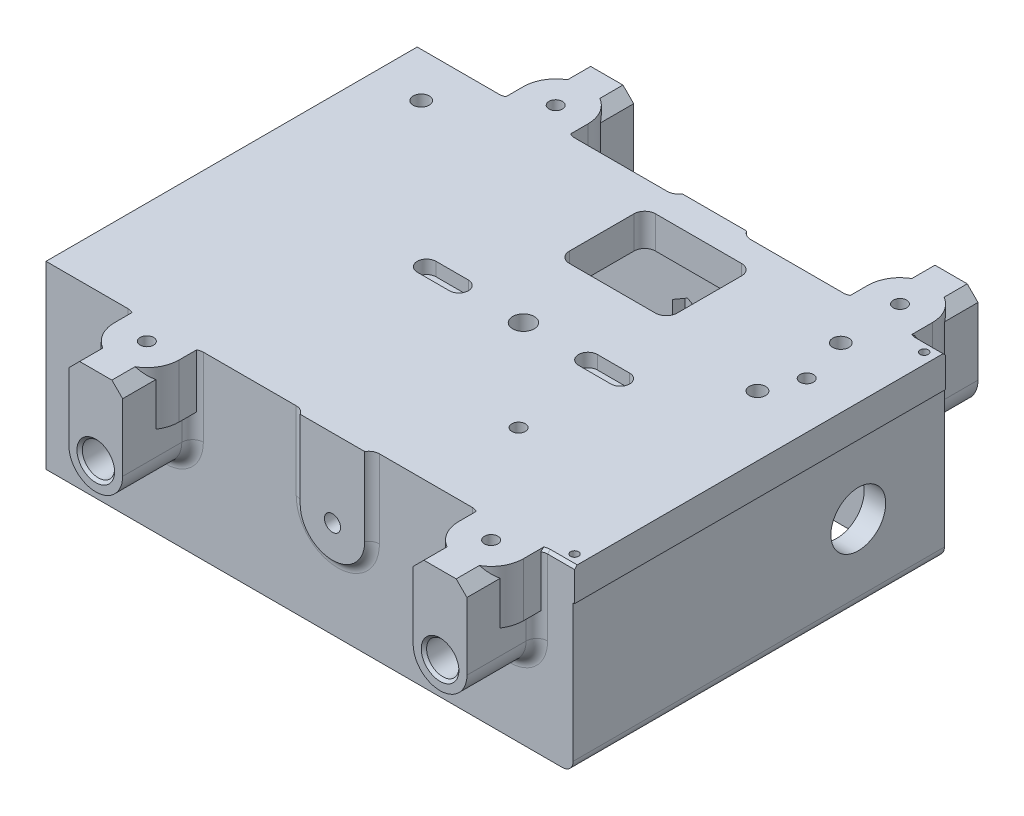
from build123d import *

# Parameters (mm, degrees)
ESQUISSE2_W                   = 98.25
ESQUISSE2_H                   = 69
BOSS_EXTRU_1_DEPTH            = 6
ESQUISSE3_W                   = 98
ESQUISSE3_H                   = 69
ESQUISSE3_W_2                 = 90
ESQUISSE3_H_2                 = 61
BOSS_EXTRU_2_DEPTH            = 27.5
ESQUISSE7_W                   = 75
ESQUISSE7_H                   = 3
BOSS_EXTRU_3_DEPTH            = 22.5
ENL_V_MAT_EXTRU_1_REACH       = 68.029
ESQUISSE4_W                   = 20
ESQUISSE4_H                   = 16
ENL_V_MAT_EXTRU_2_DEPTH       = 5
ENL_V_MAT_EXTRU_3_DEPTH       = 2
CONG_4_R                      = 2
ESQUISSE9_W                   = 1.6
ESQUISSE9_H                   = 2
BOSS_EXTRU_4_DEPTH            = 6.5
CHANFREIN1_SIZE               = 0.5
ENL_V_MAT_EXTRU_4_DEPTH       = 7.5
ENL_V_MAT_EXTRU_5_REACH       = 109.473
ESQUISSE11_R                  = 5.1
CONG_5_R                      = 2
ESQUISSE15_R                  = 1.25
ENL_V_MAT_EXTRU_8_DEPTH       = 3
ENL_V_MAT_EXTRU_9_DEPTH       = 2.5
ESQUISSE18_W                  = 7.5
ESQUISSE18_H                  = 3
ENL_V_MAT_EXTRU_11_DEPTH      = 22.5
ENL_V_MAT_EXTRU_10_DEPTH      = 3
ENL_V_MAT_EXTRU_12_REACH      = 70.744
ESQUISSE19_R                  = 2
ENL_V_MAT_EXTRU_13_DEPTH      = 2.3
BOSS_EXTRU_6_DEPTH            = 1
CONG_6_R                      = 2
ENL_V_MAT_EXTRU_14_DEPTH      = 91.611895604
ENL_V_MAT_EXTRU_14_DEPTH_BACK = 91.611895604
ESQUISSE22_R                  = 1.5
BOSS_EXTRU_8_DEPTH            = 13
BOSS_EXTRU_9_DEPTH            = 13
ESQUISSE26_R                  = 3
ENL_V_MAT_EXTRU_15_DEPTH      = 5
CHANFREIN3_SIZE               = 0.5
BOSS_EXTRU_10_DEPTH           = 10
CHANFREIN4_SIZE               = 2
CONG_7_R                      = 2
ESQUISSE32_R                  = 1.25
ENL_V_MAT_EXTRU_18_DEPTH      = 10
CHANFREIN3_OF_SYM_TRIE4_SIZE  = 0.5
CHANFREIN4_OF_SYM_TRIE4_SIZE  = 2
CONG_12_R                     = 2
BOSS_EXTRU_11_DEPTH           = 3.35
ESQUISSE29_R                  = 0.75
ENL_V_MAT_EXTRU_16_DEPTH      = 5
BOSS_EXTRU_12_DEPTH           = 5.2
ESQUISSE31_R                  = 1.5
ENL_V_MAT_EXTRU_17_DEPTH      = 72.880495442
ESQUISSE33_R                  = 0.75
ENL_V_MAT_EXTRU_19_DEPTH      = 10
CHANFREIN5_SIZE               = 0.5


with BuildPart() as part:
    # Esquisse2 → Boss.-Extru.1 (new body)
    with BuildSketch(Plane(origin=(0, 0, 0), x_dir=(1, 0, 0), z_dir=(0, 1, 0))):
        Rectangle(ESQUISSE2_W, ESQUISSE2_H)
    extrude(amount=BOSS_EXTRU_1_DEPTH)

    # Esquisse3 → Boss.-Extru.2 (add)
    with BuildSketch(Plane.XZ):
        with Locations((-0.125, 0)):
            Rectangle(ESQUISSE3_W, ESQUISSE3_H)
        with Locations((-0.125, 0)):
            Rectangle(ESQUISSE3_W_2, ESQUISSE3_H_2, mode=Mode.SUBTRACT)
    extrude(amount=BOSS_EXTRU_2_DEPTH)

    # Esquisse7 → Boss.-Extru.3 (add)
    with BuildSketch(Plane.XZ):
        with Locations((7.375, -5)):
            Rectangle(ESQUISSE7_W, ESQUISSE7_H)
    extrude(amount=BOSS_EXTRU_3_DEPTH)

    # Esquisse4 → Enlèv. mat.-Extru.1 (cut, up to next)
    with BuildSketch(Plane.XZ, mode=Mode.PRIVATE) as enl_v_mat_extru_1_sk1:
        with Locations((7.875, -21.8)):
            Rectangle(ESQUISSE4_W, ESQUISSE4_H)
    enl_v_mat_extru_1_tool1 = extrude(enl_v_mat_extru_1_sk1.sketch, amount=-ENL_V_MAT_EXTRU_1_REACH, mode=Mode.PRIVATE) & part.part
    add(enl_v_mat_extru_1_tool1.solids().sort_by_distance((7.875, 0, -21.8))[0], mode=Mode.SUBTRACT)

    # Esquisse5 → Enlèv. mat.-Extru.2 (cut, symmetric)
    with BuildSketch(Plane.XY.offset(17.5)):
        with BuildLine():
            Line((44.875, -20.00392669), (44.875, -22.080817294))
            ThreePointArc((44.875, -22.080817294), (46.083005876, -23.318494685), (45.984422146, -25.045169167))
            ThreePointArc((45.984422146, -25.045169167), (46.420169167, -26.390577854), (47.765577854, -25.954830833))
            ThreePointArc((47.765577854, -25.954830833), (47.802551126, -22.259388289), (44.875, -20.00392669))
        make_face()
    enl_v_mat_extru_2 = extrude(amount=ENL_V_MAT_EXTRU_2_DEPTH, both=True, mode=Mode.SUBTRACT)

    # Esquisse6 → Enlèv. mat.-Extru.3 (cut, symmetric)
    with BuildSketch(Plane.XY.offset(17.5)):
        with BuildLine():
            Line((44.875, -22.080817294), (47.710396034, -22.080817294))
            ThreePointArc((47.710396034, -22.080817294), (48.103029418, -25.04361757), (46.400521912, -27.5))
            Line((46.400521912, -27.5), (44.875, -27.5))
            Line((44.875, -27.5), (44.875, -22.080817294))
        make_face()
    enl_v_mat_extru_3 = extrude(amount=ENL_V_MAT_EXTRU_3_DEPTH, both=True, mode=Mode.SUBTRACT)

    # Symétrie1: Enlèv. mat.-Extru.2, Enlèv. mat.-Extru.3 across plane
    add(enl_v_mat_extru_2.mirror(Plane.XY), mode=Mode.SUBTRACT)
    add(enl_v_mat_extru_3.mirror(Plane.XY), mode=Mode.SUBTRACT)

    # Congé4
    # the kernel refuses this fillet: 2 mm, written as the material it takes off along each edge
    with BuildSketch(Plane(origin=(44.875, -27.5, 20.5), x_dir=(1, 0, 0), z_dir=(0, 0, -1))) as cong_4_piece_1:
        with BuildLine():
            CenterArc((CONG_4_R, -CONG_4_R), CONG_4_R, 90, 90)
            Line((0, -CONG_4_R), (0, 0))
            Line((0, 0), (CONG_4_R, 0))
        make_face()
    extrude(amount=41, mode=Mode.SUBTRACT)
    with BuildSketch(Plane(origin=(48.875, -27.5, -39.5), x_dir=(0, 1, 0), z_dir=(0, 0, 1))) as cong_4_piece_2:
        with BuildLine():
            CenterArc((CONG_4_R, CONG_4_R), CONG_4_R, 180, 90)
            Line((0, CONG_4_R), (0, 0))
            Line((0, 0), (CONG_4_R, 0))
        make_face()
    extrude(amount=79, mode=Mode.SUBTRACT)
    with BuildSketch(Plane(origin=(44.875, -27.5, -14.5), x_dir=(1, 0, 0), z_dir=(0, 0, -1)), Plane(origin=(44.875, -27.5, 30.5), x_dir=(1, 0, 0), z_dir=(0, 0, -1))) as cong_4_piece_3:
        with BuildLine():
            CenterArc((CONG_4_R, -CONG_4_R), CONG_4_R, 90, 90)
            Line((0, -CONG_4_R), (0, 0))
            Line((0, 0), (CONG_4_R, 0))
        make_face()
    extrude(amount=16, mode=Mode.SUBTRACT)

    # Esquisse9 → Boss.-Extru.4 (add, symmetric)
    with BuildSketch(Plane.XY.offset(-10)):
        with Locations((-44.325, -24.5)):
            Rectangle(ESQUISSE9_W, ESQUISSE9_H)
    extrude(amount=BOSS_EXTRU_4_DEPTH, both=True)

    # Chanfrein1
    chanfrein1_edges = [part.edges().sort_by_distance(p)[0] for p in [
        (-43.525, -25.5, -10),
        (-43.525, -23.5, -10),
    ]]
    chamfer(chanfrein1_edges, length=CHANFREIN1_SIZE)

    # Esquisse10 → Enlèv. mat.-Extru.4 (cut, symmetric)
    with BuildSketch(Plane.XY.offset(-10)):
        with BuildLine():
            Line((-45.125, -25.5), (-45.125, -27.5))
            Line((-45.125, -27.5), (-48.125, -27.5))
            ThreePointArc((-48.125, -27.5), (-46.811551486, -26.220172772), (-45.125, -25.5))
        make_face()
    extrude(amount=ENL_V_MAT_EXTRU_4_DEPTH, both=True, mode=Mode.SUBTRACT)

    # Esquisse11 → Enlèv. mat.-Extru.5 (cut, up to next)
    with BuildSketch(Plane(origin=(48.875, 0, 0), x_dir=(0, 0, -1), z_dir=(1, 0, 0)), mode=Mode.PRIVATE) as enl_v_mat_extru_5_sk1:
        with Locations((18.5, -13)):
            Circle(ESQUISSE11_R)
    enl_v_mat_extru_5_tool1 = extrude(enl_v_mat_extru_5_sk1.sketch, amount=-ENL_V_MAT_EXTRU_5_REACH, mode=Mode.PRIVATE) & part.part
    add(enl_v_mat_extru_5_tool1.solids().sort_by_distance((48.875, -13, -18.5))[0], mode=Mode.SUBTRACT)

    # Congé5
    cong_5_edges = [part.edges().sort_by_distance(p)[0] for p in [
        (-2.125, 3, -29.8),
        (-2.125, 3, -13.8),
        (17.875, 3, -13.8),
        (17.875, 3, -29.8),
    ]]
    fillet(cong_5_edges, radius=CONG_5_R)

    # Esquisse15 → Enlèv. mat.-Extru.8 (cut)
    with BuildSketch(Plane(origin=(0, 6, 0), x_dir=(1, 0, 0), z_dir=(0, 1, 0))):
        with Locations(Location((40.425, 17.355, 0), (0, 0, 270))):
            Circle(ESQUISSE15_R)
        with Locations(Location((21.575, -17.355, 0), (0, 0, 270))):
            Circle(ESQUISSE15_R)
    extrude(amount=-ENL_V_MAT_EXTRU_8_DEPTH, mode=Mode.SUBTRACT)

    # Esquisse16 → Enlèv. mat.-Extru.9 (cut)
    with BuildSketch(Plane(origin=(0, 6, 0), x_dir=(1, 0, 0), z_dir=(0, 1, 0))):
        with BuildLine():
            Line((-12.875, 1.75), (-6.875, 1.75))
            ThreePointArc((-6.875, 1.75), (-5.125, 0), (-6.875, -1.75))
            Line((-6.875, -1.75), (-12.875, -1.75))
            ThreePointArc((-12.875, -1.75), (-14.625, 0), (-12.875, 1.75))
        make_face()
        with BuildLine():
            Line((23.125, 1.75), (17.125, 1.75))
            ThreePointArc((17.125, 1.75), (15.375, 0), (17.125, -1.75))
            Line((17.125, -1.75), (23.125, -1.75))
            ThreePointArc((23.125, -1.75), (24.875, 0), (23.125, 1.75))
        make_face()
    extrude(amount=-ENL_V_MAT_EXTRU_9_DEPTH, mode=Mode.SUBTRACT)

    # Esquisse18 → Enlèv. mat.-Extru.11 (cut)
    with BuildSketch(Plane.XZ.offset(22.5)):
        with Locations((5.125, -5)):
            Rectangle(ESQUISSE18_W, ESQUISSE18_H)
    extrude(amount=-ENL_V_MAT_EXTRU_11_DEPTH, mode=Mode.SUBTRACT)

    # Esquisse17 → Enlèv. mat.-Extru.10 (cut)
    with BuildSketch(Plane.XZ):
        Polygon((5.125, 4.099186911), (1.575, 2.049593456), (1.575, -2.049593456), (5.125, -4.099186911), (8.675, -2.049593456), (8.675, 2.049593456), align=None)
    extrude(amount=-ENL_V_MAT_EXTRU_10_DEPTH, mode=Mode.SUBTRACT)

    # Esquisse19 → Enlèv. mat.-Extru.12 (cut, up to next)
    with BuildSketch(Plane(origin=(0, 6, 0), x_dir=(1, 0, 0), z_dir=(0, 1, 0)), mode=Mode.PRIVATE) as enl_v_mat_extru_12_sk1:
        with Locations(Location((5.125, 0, 0), (0, 0, 270))):
            Circle(ESQUISSE19_R)
    enl_v_mat_extru_12_tool1 = extrude(enl_v_mat_extru_12_sk1.sketch, amount=-ENL_V_MAT_EXTRU_12_REACH, mode=Mode.PRIVATE) & part.part
    add(enl_v_mat_extru_12_tool1.solids().sort_by_distance((5.125, 6, 0))[0], mode=Mode.SUBTRACT)

    # Esquisse20 → Enlèv. mat.-Extru.13 (cut)
    with BuildSketch(Plane(origin=(0, 0, 30.5), x_dir=(-1, 0, 0), z_dir=(0, 0, -1))):
        Polygon((-5.125, -5.295706006), (-7.9, -6.897853003), (-7.9, -10.102146997), (-5.125, -11.704293994), (-2.35, -10.102146997), (-2.35, -6.897853003), align=None)
    enl_v_mat_extru_13 = extrude(amount=-ENL_V_MAT_EXTRU_13_DEPTH, mode=Mode.SUBTRACT)

    # Symétrie2: Enlèv. mat.-Extru.13 across plane
    add(enl_v_mat_extru_13.mirror(Plane.XY), mode=Mode.SUBTRACT)

    # Esquisse21 → Boss.-Extru.6 (add)
    with BuildSketch(Plane.XY.offset(34.5)):
        with BuildLine():
            Line((-0.875, 6), (11.125, 6))
            Line((11.125, 6), (11.125, -8.5))
            ThreePointArc((11.125, -8.5), (5.125, -14.5), (-0.875, -8.5))
            Line((-0.875, -8.5), (-0.875, 6))
        make_face()
    boss_extru_6 = extrude(amount=BOSS_EXTRU_6_DEPTH)

    # Symétrie3: Boss.-Extru.6 across plane
    add(boss_extru_6.mirror(Plane.XY))

    # Congé6
    # the kernel refuses this fillet: 2 mm, written as the material it adds along each edge
    with BuildSketch(Plane(origin=(11.125, 6, -34.5), x_dir=(1, 0, 0), z_dir=(0, -1, 0)), Plane(origin=(-0.875, -8.5, -34.5), x_dir=(-1, 0, 0), z_dir=(0, 1, 0))) as cong_6_piece_1:
        with BuildLine():
            CenterArc((1.732050808, -2), CONG_6_R, 90, 60)
            Line((0, -1), (-0.034641016, -0.98))
            ThreePointArc((-0.034641016, -0.98), (-0.04, -0.5), (-0.04, 0))
            Line((-0.04, 0), (0, 0.04))
            Line((0, 0.04), (1.732050808, 0.04))
            Line((1.732050808, 0.04), (1.732050808, 0))
        make_face()
    extrude(amount=14.5)
    with BuildSketch(Plane(origin=(5.125, -8.5, -34.5), x_dir=(1, 0, 0), z_dir=(0, 1, 0))) as cong_6_piece_2:
        with BuildLine():
            CenterArc((7.732050808, 2), CONG_6_R, 210, 60)
            Line((6, 1), (5.965358984, 0.98))
            ThreePointArc((5.965358984, 0.98), (5.96, 0.5), (5.96, 0))
            Line((5.96, 0), (6, -0.04))
            Line((6, -0.04), (7.732050808, -0.04))
            Line((7.732050808, -0.04), (7.732050808, 0))
        make_face()
    revolve(axis=Axis((5.125, -8.5, -34.5), (0, 0, -1)), revolution_arc=180)
    with BuildSketch(Plane(origin=(11.125, 6, 34.5), x_dir=(1, 0, 0), z_dir=(0, -1, 0)), Plane(origin=(-0.875, -8.5, 34.5), x_dir=(-1, 0, 0), z_dir=(0, 1, 0))) as cong_6_piece_3:
        with BuildLine():
            CenterArc((1.732050808, 2), CONG_6_R, 210, 60)
            Line((0, 1), (-0.034641016, 0.98))
            ThreePointArc((-0.034641016, 0.98), (-0.04, 0.5), (-0.04, 0))
            Line((-0.04, 0), (0, -0.04))
            Line((0, -0.04), (1.732050808, -0.04))
            Line((1.732050808, -0.04), (1.732050808, 0))
        make_face()
    extrude(amount=14.5)
    with BuildSketch(Plane(origin=(5.125, -8.5, 34.5), x_dir=(1, 0, 0), z_dir=(0, 1, 0))) as cong_6_piece_4:
        with BuildLine():
            CenterArc((7.732050808, -2), CONG_6_R, 90, 60)
            Line((6, -1), (5.965358984, -0.98))
            ThreePointArc((5.965358984, -0.98), (5.96, -0.5), (5.96, 0))
            Line((5.96, 0), (6, 0.04))
            Line((6, 0.04), (7.732050808, 0.04))
            Line((7.732050808, 0.04), (7.732050808, 0))
        make_face()
    revolve(axis=Axis((5.125, -8.5, 34.5), (0, 0, -1)), revolution_arc=180)

    # Esquisse22 → Enlèv. mat.-Extru.14 (cut, two sides: drawn at the far end of the back side and taken through both)
    with BuildSketch(Plane.XY.offset(35.5).offset(-ENL_V_MAT_EXTRU_14_DEPTH_BACK)):
        with Locations((5.125, -8.5)):
            Circle(ESQUISSE22_R)
    extrude(amount=ENL_V_MAT_EXTRU_14_DEPTH + ENL_V_MAT_EXTRU_14_DEPTH_BACK, mode=Mode.SUBTRACT)

    # Esquisse24 → Boss.-Extru.8 (add)
    with BuildSketch(Plane.XY.offset(34.5)):
        with BuildLine():
            Line((42.125, -8.5), (42.125, 6))
            Line((42.125, 6), (32.125, 6))
            Line((32.125, 6), (32.125, -8.5))
            ThreePointArc((32.125, -8.5), (37.125, -13.5), (42.125, -8.5))
        make_face()
    boss_extru_8 = extrude(amount=BOSS_EXTRU_8_DEPTH)

    # Esquisse25 → Boss.-Extru.9 (add)
    with BuildSketch(Plane.XY.offset(34.5)):
        with BuildLine():
            Line((-21.875, -8.5), (-21.875, 6))
            Line((-21.875, 6), (-31.875, 6))
            Line((-31.875, 6), (-31.875, -8.5))
            ThreePointArc((-31.875, -8.5), (-26.875, -13.5), (-21.875, -8.5))
        make_face()
    boss_extru_9 = extrude(amount=BOSS_EXTRU_9_DEPTH)

    # Esquisse26 → Enlèv. mat.-Extru.15 (cut)
    with BuildSketch(Plane.XY.offset(47.5)):
        with Locations((-26.875, -8.5)):
            Circle(ESQUISSE26_R)
        with Locations((37.125, -8.5)):
            Circle(ESQUISSE26_R)
    enl_v_mat_extru_15 = extrude(amount=-ENL_V_MAT_EXTRU_15_DEPTH, mode=Mode.SUBTRACT)

    # Chanfrein3
    chanfrein3_edges = [part.edges().sort_by_distance(p)[0] for p in [
        (-29.875, -8.5, 47.5),
        (34.125, -8.5, 47.5),
    ]]
    chamfer(chanfrein3_edges, length=CHANFREIN3_SIZE)

    # Esquisse27 → Boss.-Extru.10 (add)
    with BuildSketch(Plane(origin=(0, 6, 0), x_dir=(1, 0, 0), z_dir=(0, 1, 0))):
        with BuildLine():
            Line((-32.875, -38), (-32.875, -34.5))
            Line((-32.875, -34.5), (-20.875, -34.5))
            Line((-20.875, -34.5), (-20.875, -38))
            ThreePointArc((-20.875, -38), (-26.875, -44), (-32.875, -38))
        make_face()
        with BuildLine():
            Line((31.125, -38), (31.125, -34.5))
            Line((31.125, -34.5), (43.125, -34.5))
            Line((43.125, -34.5), (43.125, -38))
            ThreePointArc((43.125, -38), (37.125, -44), (31.125, -38))
        make_face()
    boss_extru_10 = extrude(amount=-BOSS_EXTRU_10_DEPTH)

    # Chanfrein4
    chanfrein4_edges = [part.edges().sort_by_distance(p)[0] for p in [
        (42.125, 6, 44.408312395),
        (32.125, 6, 44.408312395),
        (-21.875, 6, 44.408312395),
        (-31.875, 6, 44.408312395),
    ]]
    chamfer(chanfrein4_edges, length=CHANFREIN4_SIZE)

    # Congé7
    cong_7_edges = [part.edges().sort_by_distance(p)[0] for p in [
        (-21.875, -6.25, 34.5),
        (-31.875, -6.25, 34.5),
        (-26.875, -13.5, 34.5),
        (37.125, -13.5, 34.5),
        (32.125, -6.25, 34.5),
        (42.125, -6.25, 34.5),
    ]]
    fillet(cong_7_edges, radius=CONG_7_R)

    # Esquisse32 → Enlèv. mat.-Extru.18 (cut)
    with BuildSketch(Plane(origin=(0, 6, 0), x_dir=(1, 0, 0), z_dir=(0, 1, 0))):
        with Locations(Location((-26.875, -38, 0), (0, 0, 270))):
            Circle(ESQUISSE32_R)
        with Locations(Location((37.125, -38, 0), (0, 0, 270))):
            Circle(ESQUISSE32_R)
    enl_v_mat_extru_18 = extrude(amount=-ENL_V_MAT_EXTRU_18_DEPTH, mode=Mode.SUBTRACT)

    # Symétrie4: Boss.-Extru.8, Boss.-Extru.9, Enlèv. mat.-Extru.15, Boss.-Extru.10, Enlèv. mat.-Extru.18 across plane
    add(boss_extru_8.mirror(Plane.XY))
    add(boss_extru_9.mirror(Plane.XY))
    add(enl_v_mat_extru_15.mirror(Plane.XY), mode=Mode.SUBTRACT)
    add(boss_extru_10.mirror(Plane.XY))
    add(enl_v_mat_extru_18.mirror(Plane.XY), mode=Mode.SUBTRACT)

    # Chanfrein3 of Symétrie4
    chanfrein3_of_sym_trie4_edges = [part.edges().sort_by_distance(p)[0] for p in [
        (-29.875, -8.5, -47.5),
        (34.125, -8.5, -47.5),
    ]]
    chamfer(chanfrein3_of_sym_trie4_edges, length=CHANFREIN3_OF_SYM_TRIE4_SIZE)

    # Chanfrein4 of Symétrie4
    chanfrein4_of_sym_trie4_edges = [part.edges().sort_by_distance(p)[0] for p in [
        (42.125, 6, -44.408312395),
        (32.125, 6, -44.408312395),
        (-21.875, 6, -44.408312395),
        (-31.875, 6, -44.408312395),
    ]]
    chamfer(chanfrein4_of_sym_trie4_edges, length=CHANFREIN4_OF_SYM_TRIE4_SIZE)

    # Congé12
    cong_12_edges = [part.edges().sort_by_distance(p)[0] for p in [
        (37.125, -13.5, -34.5),
        (-26.875, -13.5, -34.5),
        (32.125, -6.25, -34.5),
        (42.125, -6.25, -34.5),
        (-31.875, -6.25, -34.5),
        (-21.875, -6.25, -34.5),
    ]]
    fillet(cong_12_edges, radius=CONG_12_R)

    # Esquisse28 → Boss.-Extru.11 (add)
    with BuildSketch(Plane.ZY.offset(-44.875)):
        with BuildLine():
            Line((-8.4, -16), (-6.5, -16))
            Line((-6.5, -16), (-6.5, -10))
            Line((-6.5, -10), (-8.4, -10))
            ThreePointArc((-8.4, -10), (-11.4, -13), (-8.4, -16))
        make_face()
        with BuildLine():
            Line((-28.6, -16), (-30.5, -16))
            Line((-30.5, -16), (-30.5, -10))
            Line((-30.5, -10), (-28.6, -10))
            ThreePointArc((-28.6, -10), (-25.6, -13), (-28.6, -16))
        make_face()
    extrude(amount=BOSS_EXTRU_11_DEPTH)

    # Esquisse29 → Enlèv. mat.-Extru.16 (cut)
    with BuildSketch(Plane.ZY.offset(-41.525)):
        with Locations((-28.6, -13)):
            Circle(ESQUISSE29_R)
        with Locations((-8.4, -13)):
            Circle(ESQUISSE29_R)
    extrude(amount=-ENL_V_MAT_EXTRU_16_DEPTH, mode=Mode.SUBTRACT)

    # Esquisse30 → Boss.-Extru.12 (add)
    with BuildSketch(Plane.XZ):
        with BuildLine():
            Line((40.375, -6.5), (35.375, -6.5))
            Line((35.375, -6.5), (35.375, -10.75))
            ThreePointArc((35.375, -10.75), (37.875, -13.25), (40.375, -10.75))
            Line((40.375, -10.75), (40.375, -6.5))
        make_face()
        with BuildLine():
            Line((35.375, -30.5), (40.375, -30.5))
            Line((40.375, -30.5), (40.375, -26.25))
            ThreePointArc((40.375, -26.25), (37.875, -23.75), (35.375, -26.25))
            Line((35.375, -26.25), (35.375, -30.5))
        make_face()
        with BuildLine():
            Line((-45.125, -30.5), (-37.625, -30.5))
            Line((-37.625, -30.5), (-37.625, -26.25))
            ThreePointArc((-37.625, -26.25), (-38.357233047, -24.482233047), (-40.125, -23.75))
            Line((-40.125, -23.75), (-45.125, -23.75))
            Line((-45.125, -23.75), (-45.125, -30.5))
        make_face()
    extrude(amount=BOSS_EXTRU_12_DEPTH)

    # Esquisse31 → Enlèv. mat.-Extru.17 (cut, through all)
    with BuildSketch(Plane.XZ.offset(5.2)):
        with Locations(Location((37.875, -10.75, 0), (0, 0, 270))):
            Circle(ESQUISSE31_R)
        with Locations(Location((37.875, -26.25, 0), (0, 0, 270))):
            Circle(ESQUISSE31_R)
        with Locations(Location((-40.125, -26.25, 0), (0, 0, 270))):
            Circle(ESQUISSE31_R)
    extrude(amount=-ENL_V_MAT_EXTRU_17_DEPTH, mode=Mode.SUBTRACT)

    # Esquisse33 → Enlèv. mat.-Extru.19 (cut)
    with BuildSketch(Plane(origin=(0, 6, 0), x_dir=(1, 0, 0), z_dir=(0, 1, 0))):
        with Locations(Location((47.125, 32.5, 0), (0, 0, 270))):
            Circle(ESQUISSE33_R)
        with Locations(Location((47.125, -32.5, 0), (0, 0, 90))):
            Circle(ESQUISSE33_R)
    extrude(amount=-ENL_V_MAT_EXTRU_19_DEPTH, mode=Mode.SUBTRACT)

    # Chanfrein5
    chanfrein5_edges = [part.edges().sort_by_distance(p)[0] for p in [
        (46.625, 6, -34.5),
        (46.625, 6, 34.5),
        (43.60736191, 6, 34.568148347),
        (43.60736191, 6, -34.568148347),
    ]]
    chamfer(chanfrein5_edges, length=CHANFREIN5_SIZE)


solid = part.part
